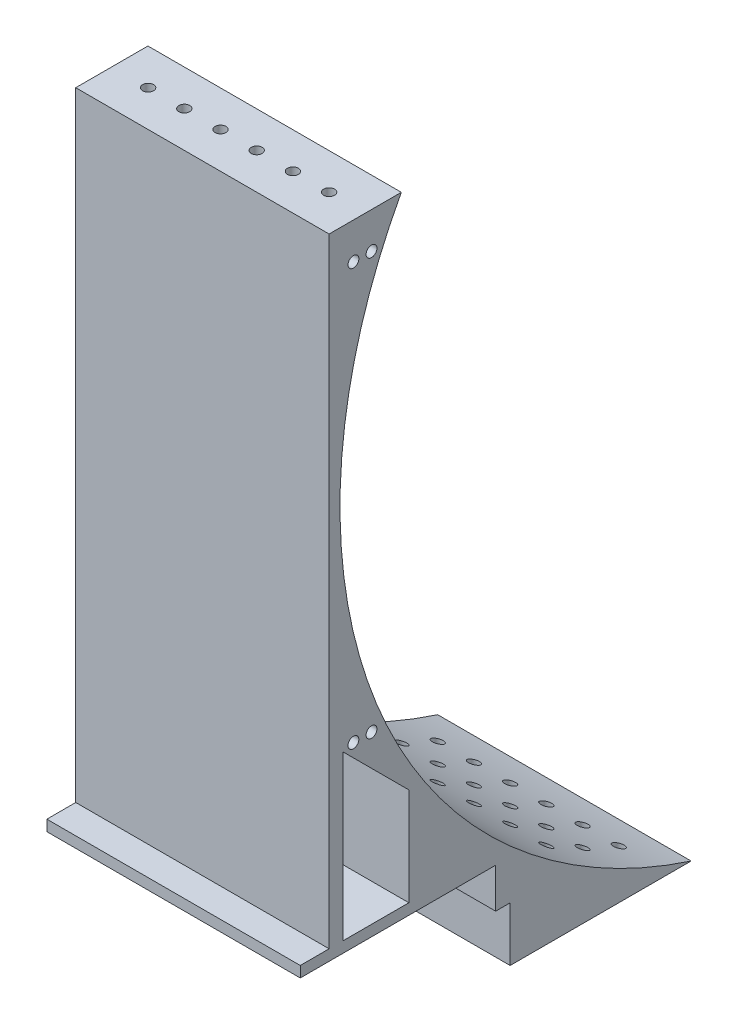
from build123d import *

# Parameters (mm, degrees)
BOSS_EXTRUDE1_DEPTH = 70
CUT_EXTRUDE2_DEPTH  = 235.307490277
SKETCH6_W           = 70
SKETCH6_H           = 3
BOSS_EXTRUDE2_DEPTH = 30
SKETCH7_R           = 1.5
CUT_EXTRUDE3_DEPTH  = 20
SKETCH8_R           = 1.5
CUT_EXTRUDE4_DEPTH  = 15
SKETCH9_R           = 1.5
CUT_EXTRUDE5_DEPTH  = 20
SKETCH10_R          = 1.5
CUT_EXTRUDE6_DEPTH  = 235.307490435


with BuildPart() as part:
    # Sketch1 → Boss-Extrude1 (new body)
    with BuildSketch(Plane(origin=(0, 0, 0), x_dir=(0, 0, -1), z_dir=(1, 0, 0))):
        with BuildLine():
            Line((0, 200), (0, 0))
            Line((0, 0), (100, 0))
            ThreePointArc((100, 0), (13.025244547, 81.208240961), (19.946550109, 200))
            Line((19.946550109, 200), (0, 200))
        make_face()
    extrude(amount=BOSS_EXTRUDE1_DEPTH)

    # Sketch5 → Cut-Extrude2 (cut, through all)
    with BuildSketch(Plane(origin=(70, 0, 0), x_dir=(0, 0, -1), z_dir=(1, 0, 0))):
        Polygon((22.027296405, 26), (22.027296405, 56), (3.858869779, 74.168426626), (3.858869779, 26), (0, 26), (0, 0), (50, 0), (50, 15), (46, 15), (46, 26), align=None)
    extrude(amount=-CUT_EXTRUDE2_DEPTH, mode=Mode.SUBTRACT)

    # Sketch6 → Boss-Extrude2 (add)
    with BuildSketch(Plane.XY.offset(-22.027296405)):
        with Locations((35, 27.5)):
            Rectangle(SKETCH6_W, SKETCH6_H)
    extrude(amount=BOSS_EXTRUDE2_DEPTH)

    # Sketch7 → Cut-Extrude3 (cut)
    with BuildSketch(Plane(origin=(0, 200, 0), x_dir=(1, 0, 0), z_dir=(0, 1, 0))):
        with Locations((10, 10)):
            Circle(SKETCH7_R)
        with Locations((20, 10)):
            Circle(SKETCH7_R)
        with Locations((30, 10)):
            Circle(SKETCH7_R)
        with Locations((40, 10)):
            Circle(SKETCH7_R)
        with Locations((50, 10)):
            Circle(SKETCH7_R)
        with Locations((60, 10)):
            Circle(SKETCH7_R)
    extrude(amount=-CUT_EXTRUDE3_DEPTH, mode=Mode.SUBTRACT)

    # Sketch8 → Cut-Extrude4 (cut)
    with BuildSketch(Plane.XZ):
        with Locations((10, -90)):
            Circle(SKETCH8_R)
        with Locations((20, -90)):
            Circle(SKETCH8_R)
        with Locations((30, -90)):
            Circle(SKETCH8_R)
        with Locations((40, -90)):
            Circle(SKETCH8_R)
        with Locations((50, -90)):
            Circle(SKETCH8_R)
        with Locations((60, -90)):
            Circle(SKETCH8_R)
        with Locations((20, -80)):
            Circle(SKETCH8_R)
        with Locations((30, -80)):
            Circle(SKETCH8_R)
        with Locations((40, -80)):
            Circle(SKETCH8_R)
        with Locations((50, -80)):
            Circle(SKETCH8_R)
        with Locations((60, -80)):
            Circle(SKETCH8_R)
        with Locations((20, -70)):
            Circle(SKETCH8_R)
        with Locations((30, -70)):
            Circle(SKETCH8_R)
        with Locations((40, -70)):
            Circle(SKETCH8_R)
        with Locations((50, -70)):
            Circle(SKETCH8_R)
        with Locations((60, -70)):
            Circle(SKETCH8_R)
        with Locations((20, -60)):
            Circle(SKETCH8_R)
        with Locations((30, -60)):
            Circle(SKETCH8_R)
        with Locations((40, -60)):
            Circle(SKETCH8_R)
        with Locations((50, -60)):
            Circle(SKETCH8_R)
        with Locations((60, -60)):
            Circle(SKETCH8_R)
        with Locations((10, -80)):
            Circle(SKETCH8_R)
        with Locations((10, -70)):
            Circle(SKETCH8_R)
        with Locations((10, -60)):
            Circle(SKETCH8_R)
    extrude(amount=-CUT_EXTRUDE4_DEPTH, mode=Mode.SUBTRACT)

    # Sketch9 → Cut-Extrude5 (cut)
    with BuildSketch(Plane.XZ.offset(-26)):
        with Locations((20, -6)):
            Circle(SKETCH9_R)
        with Locations((20, -31)):
            Circle(SKETCH9_R)
        with Locations((50, -31)):
            Circle(SKETCH9_R)
        with Locations((50, -6)):
            Circle(SKETCH9_R)
    extrude(amount=-CUT_EXTRUDE5_DEPTH, mode=Mode.SUBTRACT)

    # Sketch10 → Cut-Extrude6 (cut, through all)
    with BuildSketch(Plane(origin=(70, 0, 0), x_dir=(0, 0, -1), z_dir=(1, 0, 0))):
        with Locations((6.71, 75)):
            Circle(SKETCH10_R)
        with Locations((11.71, 75)):
            Circle(SKETCH10_R)
        with Locations((6.71, 190)):
            Circle(SKETCH10_R)
        with Locations((11.71, 190)):
            Circle(SKETCH10_R)
    extrude(amount=-CUT_EXTRUDE6_DEPTH, mode=Mode.SUBTRACT)


solid = part.part
